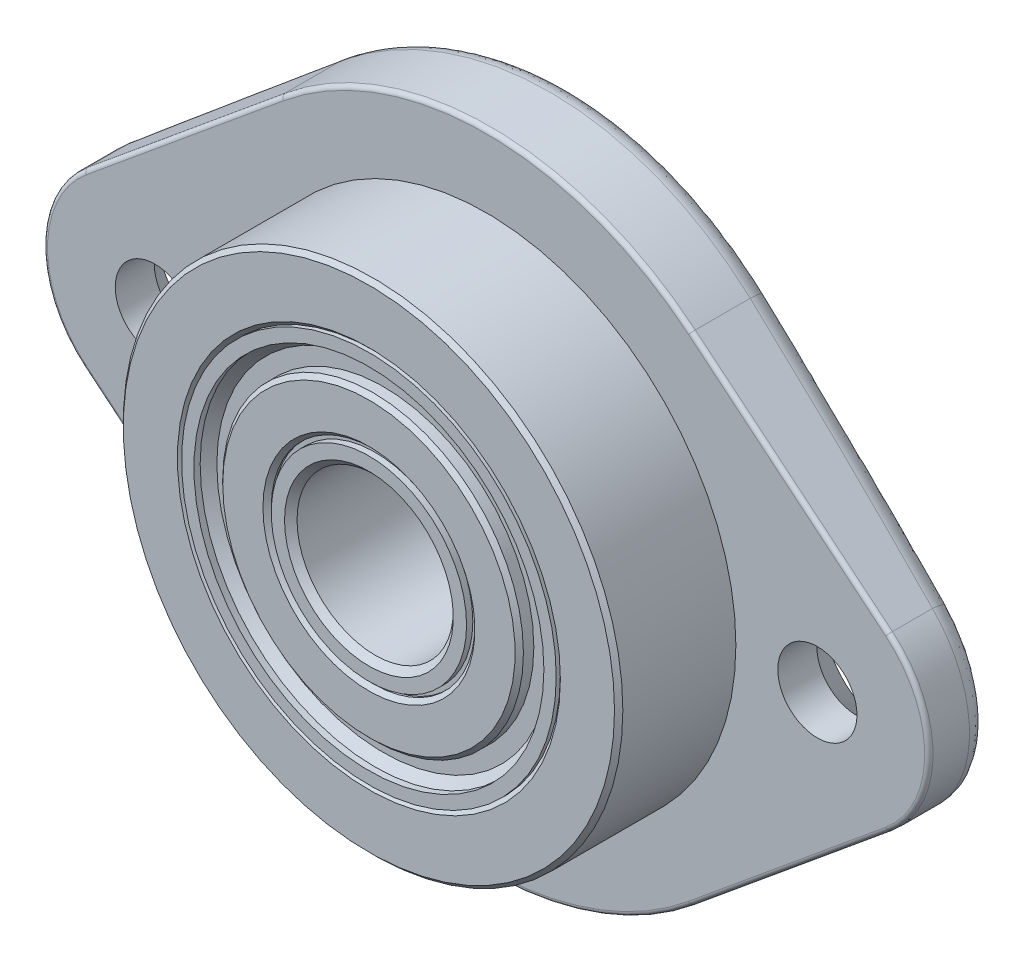
from build123d import *

# Parameters (mm, degrees)
CHAMFER2_SIZE           = 0.381
CHAMFER3_SIZE           = 0.254
CHAMFER4_SIZE           = 0.508
EXTRUDE1_START          = -6.151562
SKETCH2_R               = 2.413
EXTRUDE1_DEPTH          = 5.159375
SKETCH9_R               = 15.225117187
SKETCH9_R_2             = 11.418837891
BOSS_EXTRUDE2_DEPTH     = 7.14375
CHAMFER5_SIZE           = 0.254
CUT_EXTRUDE1_DEPTH      = 34.942674919
CUT_EXTRUDE1_DEPTH_BACK = 34.942674919
FILLET2_R               = 1.27
FILLET3_R               = 0.254


with BuildPart() as part:
    # Sketch3 → Revolve1 (revolve)
    with BuildSketch(Plane(origin=(0, 0, 0), x_dir=(0, 0, -1), z_dir=(1, 0, 0)), mode=Mode.PRIVATE) as revolve1_sk:
        Polygon((-6.1515625, 5.953125), (-5.7705625, 5.953125), (-5.7705625, 6.207125), (-6.1515625, 6.207125), (-6.1515625, 9.165497396), (-5.2625625, 9.165497396), (-5.2625625, 10.667724392), (-6.1515625, 10.667724392), (-6.1515625, 11.418837891), (0.9921875, 11.418837891), (0.9921875, 4.7625), (-6.1515625, 4.7625), align=None)
    revolve(revolve1_sk.sketch.rotate(Axis((0, 0, 6.1515625), (0, 0, -1)), 90), axis=Axis((0, 0, 6.1515625), (0, 0, -1)))

    # Chamfer2
    chamfer2_edges = [part.edges().sort_by_distance(p)[0] for p in [
        (-4.7625, 0, 6.1515625),
    ]]
    chamfer(chamfer2_edges, length=CHAMFER2_SIZE)

    # Chamfer3
    chamfer3_edges = [part.edges().sort_by_distance(p)[0] for p in [
        (-6.207125, 0, 6.1515625),
        (-9.165497396, 0, 6.1515625),
    ]]
    chamfer(chamfer3_edges, length=CHAMFER3_SIZE)

    # Chamfer4
    chamfer4_edges = [part.edges().sort_by_distance(p)[0] for p in [
        (-10.667724392, 0, 5.2625625),
    ]]
    chamfer(chamfer4_edges, length=CHAMFER4_SIZE)


with BuildPart() as body_2:
    # Sketch2 → Extrude1 (new body)
    with BuildSketch(Plane.XY.offset(EXTRUDE1_START)):
        with BuildLine():
            Line((24.517015527, 5.241003718), (12.502264519, 15.15360304))
            ThreePointArc((12.502264519, 15.15360304), (0, 19.6453125), (-12.502264519, 15.15360304))
            Line((-12.502264519, 15.15360304), (-24.517015527, 5.241003718))
            ThreePointArc((-24.517015527, 5.241003718), (-26.9875, 0), (-24.517015527, -5.241003718))
            Line((-24.517015527, -5.241003718), (-12.502264519, -15.15360304))
            ThreePointArc((-12.502264519, -15.15360304), (0, -19.6453125), (12.502264519, -15.15360304))
            Line((12.502264519, -15.15360304), (24.517015527, -5.241003718))
            ThreePointArc((24.517015527, -5.241003718), (26.9875, 0), (24.517015527, 5.241003718))
        make_face()
        with Locations((20.193, 0)):
            Circle(SKETCH2_R, mode=Mode.SUBTRACT)
        with Locations((-20.193, 0)):
            Circle(SKETCH2_R, mode=Mode.SUBTRACT)
    extrude(amount=EXTRUDE1_DEPTH)

    # Sketch9 → Boss-Extrude2 (add)
    with BuildSketch(Plane.XY.offset(-0.9921875)):
        Circle(SKETCH9_R)
        Circle(SKETCH9_R_2, mode=Mode.SUBTRACT)
    extrude(amount=BOSS_EXTRUDE2_DEPTH)

    # Chamfer5
    chamfer5_edges = [body_2.edges().sort_by_distance(p)[0] for p in [
        (-15.225117187, 0, 6.1515625),
        (-11.418837891, 0, 6.1515625),
    ]]
    chamfer(chamfer5_edges, length=CHAMFER5_SIZE)

    # Cut-Extrude2 cone 1 section (through the dimple's axis) → Cut-Extrude2 (revolve, cut)
    with BuildSketch(Plane(origin=(20.193, 0, -6.1515625), x_dir=(0, 1, 0), z_dir=(1, 0, 0))):
        Polygon((0, 0), (4.826, 0), (0, 5.551677933), align=None)
    revolve(axis=Axis((20.193, 0, -6.1515625), (0, 0, 1)), mode=Mode.SUBTRACT)

    # Cut-Extrude2 cone 2 section (through the dimple's axis) → Cut-Extrude2 cone 2 (revolve, cut)
    with BuildSketch(Plane(origin=(-20.193, 0, -6.1515625), x_dir=(0, 1, 0), z_dir=(1, 0, 0))):
        Polygon((0, 0), (4.826, 0), (0, 5.551677933), align=None)
    revolve(axis=Axis((-20.193, 0, -6.1515625), (0, 0, 1)), mode=Mode.SUBTRACT)

    # Sketch5 → Cut-Extrude1 (cut, two sides: drawn at the far end of the back side and taken through both)
    with BuildSketch(Plane(origin=(0, 0, 0), x_dir=(1, 0, 0), z_dir=(0, 1, 0)).offset(-CUT_EXTRUDE1_DEPTH_BACK)):
        with BuildLine():
            Line((-26.9875, 4.60375), (-26.9875, 6.6595625))
            Line((-26.9875, 6.6595625), (26.9875, 6.6595625))
            Line((26.9875, 6.6595625), (26.9875, 4.60375))
            ThreePointArc((26.9875, 4.60375), (0, 6.1515625), (-26.9875, 4.60375))
        make_face()
    extrude(amount=CUT_EXTRUDE1_DEPTH + CUT_EXTRUDE1_DEPTH_BACK, mode=Mode.SUBTRACT)

    # Fillet2
    fillet2_edges = [body_2.edges().sort_by_distance(p)[0] for p in [
        (6.651147603, 18.485143795, -6.057839469),
        (-6.651147603, -18.485143795, -6.057839469),
        (18.513239588, -10.19433361, -5.424450893),
        (26.337764274, 2.899500312, -4.677611985),
        (18.513239588, 10.19433361, -5.424450893),
        (-18.513239588, 10.19433361, -5.424450893),
        (-26.9875, 0, -4.60375),
        (-18.513239588, -10.19433361, -5.424450893),
    ]]
    fillet(fillet2_edges, radius=FILLET2_R)

    # Fillet3
    fillet3_edges = [body_2.edges().sort_by_distance(p)[0] for p in [
        (0, 19.6453125, -0.992187),
        (-18.509640023, 10.197303379, -0.992187),
        (-26.9875, 0, -0.992187),
        (-18.509640023, -10.197303379, -0.992187),
        (0, -19.6453125, -0.992187),
        (18.509640023, -10.197303379, -0.992187),
        (26.9875, 0, -0.992187),
        (18.509640023, 10.197303379, -0.992187),
    ]]
    fillet(fillet3_edges, radius=FILLET3_R)


solid = Compound([part.part, body_2.part])
